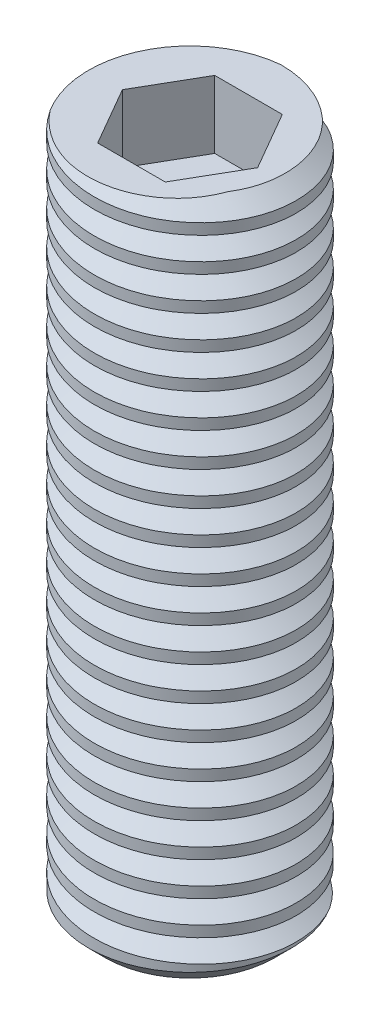
from build123d import *

# Parameters (mm, degrees)
CROQUIS1_R           = 1.5
EXTRUIR1_DEPTH       = 10
CORTAR_BARRER1_PITCH = 0.4999999999999973
EXTRUIR2_DEPTH       = 1
EXTRUIR3_DEPTH       = 1
CHAFL_N1_SIZE        = 0.25


with BuildPart() as part:
    # Croquis1 → Extruir1 (new body)
    with BuildSketch(Plane(origin=(0, 0, 0), x_dir=(1, 0, 0), z_dir=(0, 1, 0))):
        with Locations(Location((0, 0, 0), (0, 0, 270))):
            Circle(CROQUIS1_R)
    extrude(amount=EXTRUIR1_DEPTH)

    # Cortar-Barrer1: arcs per turn and ends read off the stored shape
    # Cortar-Barrer1: the profile of Croquis3 screwed along a left-hand helix through 44 turns, 6 arcs to a turn; built about Z, then put on its axis
    cortar_barrer1_z = Axis((0, 0, 0), (0, 0, 1))
    cortar_barrer1_corners = [(1.207019816, 1.053e-06, 0.214105875), (1.640032518, 1.431e-06, -0.035894125), (1.773466254, 1.548e-06, -0.035894125), (1.773466254, 1.548e-06, 0.464105875), (1.640032518, 1.431e-06, 0.464105875)]
    with BuildLine(mode=Mode.PRIVATE) as cortar_barrer1_profile:
        Line(cortar_barrer1_corners[0], cortar_barrer1_corners[1])
        Line(cortar_barrer1_corners[1], cortar_barrer1_corners[2])
        Line(cortar_barrer1_corners[2], cortar_barrer1_corners[3])
        Line(cortar_barrer1_corners[3], cortar_barrer1_corners[4])
        Line(cortar_barrer1_corners[4], cortar_barrer1_corners[0])
    cortar_barrer1_cap = Face(cortar_barrer1_profile.wire())
    cortar_barrer1_turn_angles = [0, -30, -60, -90, -120, -150, -180, -210, -240, -270, -300, -330, -360]
    cortar_barrer1_turn_weights = [1, 0.8660254037844387, 1, 0.8660254037844387, 1, 0.8660254037844387, 1, 0.8660254037844387, 1, 0.8660254037844387, 1, 0.8660254037844387, 1]
    cortar_barrer1_turn_rails = [Edge.make_bspline([Vector(p[0], p[1], 0).rotate(cortar_barrer1_z, cortar_barrer1_turn_angles[k]) / cortar_barrer1_turn_weights[k] + Vector(0, 0, p[2] + -CORTAR_BARRER1_PITCH * cortar_barrer1_turn_angles[k] / 360) for k in range(13)], [0, 0, 0, 1, 1, 2, 2, 3, 3, 4, 4, 5, 5, 6, 6, 6], 2, cortar_barrer1_turn_weights) for p in cortar_barrer1_corners]
    cortar_barrer1_turn_sides = [Face.make_surface_from_curves(cortar_barrer1_turn_rails[p[0]], cortar_barrer1_turn_rails[p[1]]) for p in [(0, 1), (1, 2), (2, 3), (3, 4), (4, 0)]]
    cortar_barrer1 = Plane(origin=(0, 0, 0), x_dir=(-1, 0, 1.047e-14), z_dir=(0, 1, 0)) * Solid(Shell([*[p.moved(Location((0, 0, CORTAR_BARRER1_PITCH * i))) for i in range(44) for p in cortar_barrer1_turn_sides], cortar_barrer1_cap, cortar_barrer1_cap.rotate(cortar_barrer1_z, -15840).moved(Location((0, 0, -CORTAR_BARRER1_PITCH * -15840 / 360)))]))
    add(cortar_barrer1, mode=Mode.SUBTRACT)

    # Croquis4 → Extruir2 (cut)
    with BuildSketch(Plane(origin=(0, 10, 0), x_dir=(1, 0, 0), z_dir=(0, 1, 0))):
        Polygon((0.5, 0.8660254037844387), (-0.5, 0.8660254037844387), (-0.9999999999999996, -1.1e-16), (-0.4999999999999993, -0.8660254037844389), (0.5000000000000002, -0.8660254037844387), (1.0000000000000002, 1.2e-16), align=None)
    extrude(amount=-EXTRUIR2_DEPTH, mode=Mode.SUBTRACT)

    # Croquis5 → Extruir3 (cut)
    with BuildSketch(Plane.XZ):
        Polygon((0.4999999999999998, 0.866025403784439), (-0.5000000000000002, 0.8660254037844388), (-1.0000000000000002, -8.7e-16), (-0.4999999999999998, -0.8660254037844393), (0.5000000000000004, -0.8660254037844389), (1.0000000000000004, 3.5e-16), align=None)
    extrude(amount=-EXTRUIR3_DEPTH, mode=Mode.SUBTRACT)

    # Chaflán1
    # the kernel refuses this chamfer: 0.25 mm, written as the material it takes off along each edge
    with BuildSketch(Plane(origin=(0, 0, 0), x_dir=(-1.8e-16, 0, 1), z_dir=(-1, 0, -1.8e-16))) as chafl_n1_piece_1:
        Polygon((1.5, CHAFL_N1_SIZE), (1.5 - CHAFL_N1_SIZE, 0), (1.5, 0), align=None)
    revolve(axis=Axis((0, 0, 0), (0, 1, 0)), mode=Mode.SUBTRACT)


solid = part.part
